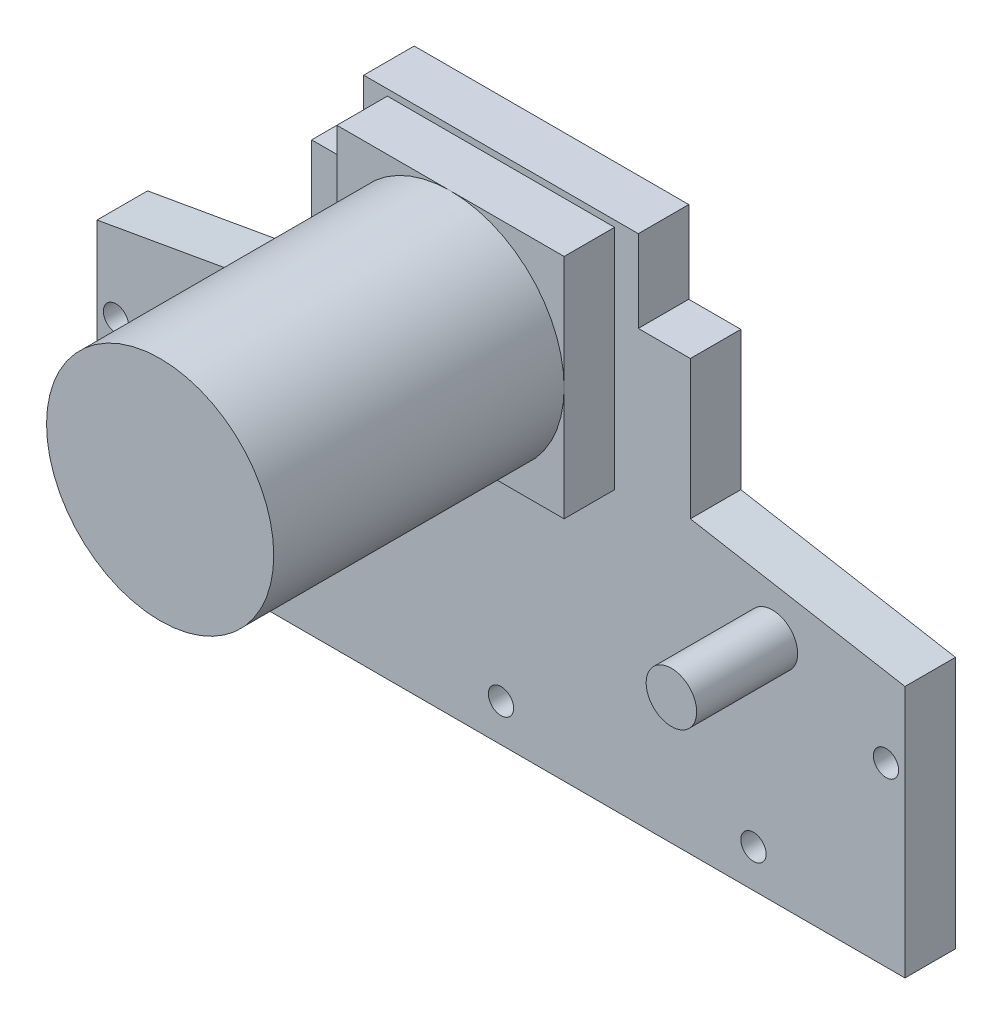
from build123d import *

# Parameters (mm, degrees)
BOSS_EXTRUDE1_DEPTH = 4
SKETCH2_R           = 1
CUT_EXTRUDE1_DEPTH  = 5
SKETCH3_R           = 9
BOSS_EXTRUDE2_DEPTH = 27
SKETCH5_W           = 18
SKETCH5_H           = 18
BOSS_EXTRUDE3_DEPTH = 3
SKETCH6_R           = 2
BOSS_EXTRUDE4_DEPTH = 8
SKETCH7_W           = 18
SKETCH7_H           = 18
BOSS_EXTRUDE5_DEPTH = 4


with BuildPart() as part:
    # Sketch1 → Boss-Extrude1 (new body)
    with BuildSketch(Plane.XY):
        Polygon((-32, 20), (-32, 0), (32, 0), (32, 20), (15, 23), (15, 34), (10.875, 34), (10.875, 40.5), (-10.875, 40.5), (-10.875, 34), (-15, 34), (-15, 23), align=None)
    extrude(amount=BOSS_EXTRUDE1_DEPTH)

    # Sketch2 → Cut-Extrude1 (cut)
    with BuildSketch(Plane.XY.offset(4)):
        with Locations((20, 3)):
            Circle(SKETCH2_R)
        with Locations((0, 3)):
            Circle(SKETCH2_R)
        with Locations((-20, 3)):
            Circle(SKETCH2_R)
        with Locations((-30.5, 14)):
            Circle(SKETCH2_R)
        with Locations((30.5, 14)):
            Circle(SKETCH2_R)
    extrude(amount=-CUT_EXTRUDE1_DEPTH, mode=Mode.SUBTRACT)

    # Sketch3 → Boss-Extrude2 (add)
    with BuildSketch(Plane.XY.offset(4)):
        with Locations((0, 31)):
            Circle(SKETCH3_R)
    extrude(amount=BOSS_EXTRUDE2_DEPTH)

    # Sketch5 → Boss-Extrude3 (add)
    with BuildSketch(Plane(origin=(0, 0, 0), x_dir=(-1, 0, 0), z_dir=(0, 0, -1))):
        with Locations((4, 19)):
            Rectangle(SKETCH5_W, SKETCH5_H)
    extrude(amount=BOSS_EXTRUDE3_DEPTH)

    # Sketch6 → Boss-Extrude4 (add)
    with BuildSketch(Plane.XY.offset(4)):
        with Locations((21.5, 18)):
            Circle(SKETCH6_R)
        with Locations((-21.5, 18)):
            Circle(SKETCH6_R)
    extrude(amount=BOSS_EXTRUDE4_DEPTH)

    # Sketch7 → Boss-Extrude5 (add)
    with BuildSketch(Plane.XY.offset(4)):
        with Locations((0, 31)):
            Rectangle(SKETCH7_W, SKETCH7_H)
    extrude(amount=BOSS_EXTRUDE5_DEPTH)


solid = part.part
